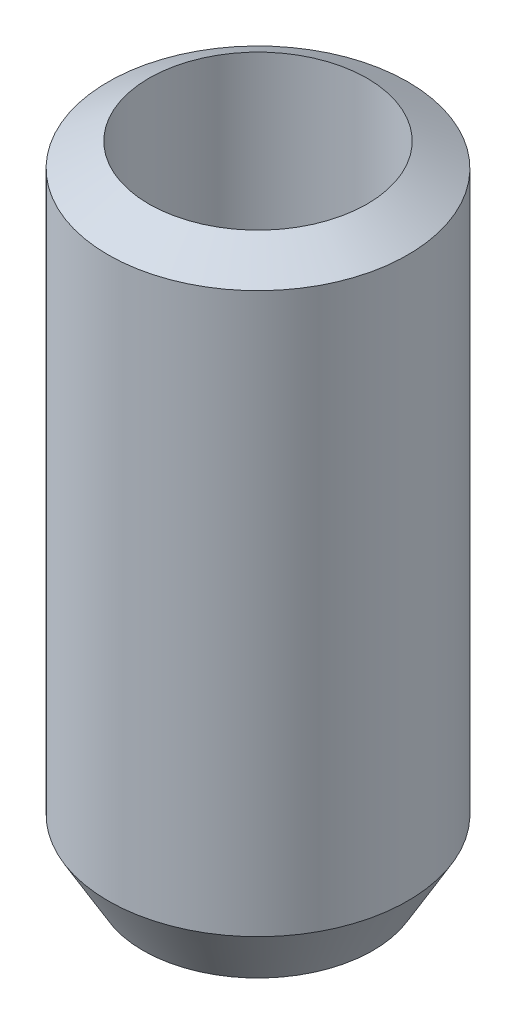
from build123d import *

# Parameters (mm, degrees)
SKETCH1_R           = 20
BOSS_EXTRUDE1_DEPTH = 87.397602
SKETCH2_R           = 14.554805518
CUT_EXTRUDE1_DEPTH  = 92.860442168
CHAMFER1_SIZE       = 4.661129
CHAMFER1_SIZE_2     = 8.073313


with BuildPart() as part:
    # Sketch1 → Boss-Extrude1 (new body)
    with BuildSketch(Plane(origin=(0, 0, 0), x_dir=(1, 0, 0), z_dir=(0, 1, 0))):
        with Locations(Location((0, 0, 0), (0, 0, 90))):
            Circle(SKETCH1_R)
    extrude(amount=BOSS_EXTRUDE1_DEPTH)

    # Sketch2 → Cut-Extrude1 (cut, through all)
    with BuildSketch(Plane(origin=(0, 0, 0), x_dir=(1, 0, 0), z_dir=(0, 1, 0))):
        with Locations(Location((0, 0, 0), (0, 0, 90))):
            Circle(SKETCH2_R)
    extrude(amount=CUT_EXTRUDE1_DEPTH, mode=Mode.SUBTRACT)

    # Chamfer1
    # the kernel refuses this chamfer: 8.073313, 4.661129 mm, written as the material it takes off along each edge
    with BuildSketch(Plane(origin=(0, 87.397602, 0), x_dir=(0, 0, -1), z_dir=(1, 0, 0))) as chamfer1_piece_1:
        Polygon((20, -CHAMFER1_SIZE), (20 - CHAMFER1_SIZE_2, 0), (20, 0), align=None)
    revolve(axis=Axis((0, 87.397602, 0), (0, 1, 0)), mode=Mode.SUBTRACT)
    with BuildSketch(Plane(origin=(0, 0, 0), x_dir=(0, 0, -1), z_dir=(1, 0, 0))) as chamfer1_piece_2:
        Polygon((20, CHAMFER1_SIZE_2), (20 - CHAMFER1_SIZE, 0), (20, 0), align=None)
    revolve(axis=Axis((0, 0, 0), (0, 1, 0)), mode=Mode.SUBTRACT)


solid = part.part
